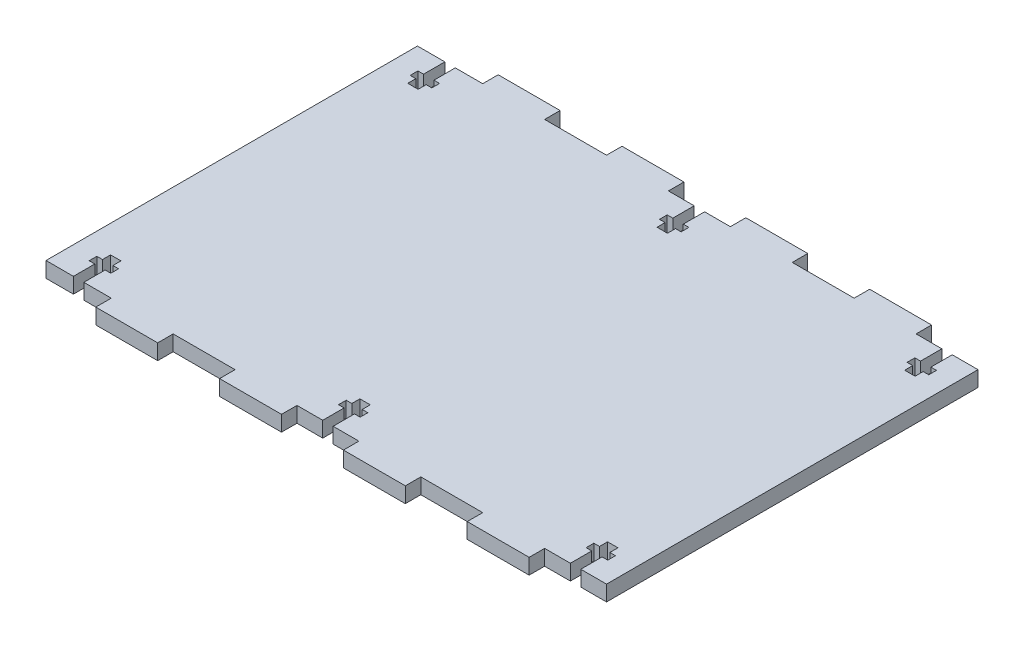
from build123d import *

# Parameters (mm, degrees)
SKETCH1_W           = 229.969358589
SKETCH1_H           = 6.35
BOSS_EXTRUDE1_DEPTH = 152.4
SKETCH2_W           = 25.4
SKETCH2_H           = 6.35
BOSS_EXTRUDE2_DEPTH = 6.35
LPATTERN1_COUNT     = 4
LPATTERN1_PITCH     = 50.8
SKETCH3_W           = 25.4
SKETCH3_H           = 6.35
BOSS_EXTRUDE3_DEPTH = 6.35
LPATTERN2_COUNT     = 4
LPATTERN2_PITCH     = 50.8
CUT_EXTRUDE1_DEPTH  = 6.35


with BuildPart() as part:
    # Sketch1 → Boss-Extrude1 (new body)
    with BuildSketch(Plane.XY):
        with Locations((-24.365205383, 152.4)):
            Rectangle(SKETCH1_W, SKETCH1_H)
    extrude(amount=BOSS_EXTRUDE1_DEPTH)

    # Sketch2 → Boss-Extrude2 (add)
    with BuildSketch(Plane(origin=(0, 155.575, 0), x_dir=(1, 0, 0), z_dir=(0, 1, 0))):
        with Locations((52.519473912, 3.175)):
            Rectangle(SKETCH2_W, SKETCH2_H)
    boss_extrude2 = extrude(amount=-BOSS_EXTRUDE2_DEPTH)

    # LPattern1: Boss-Extrude2 ×4
    with Locations(*[(-i * LPATTERN1_PITCH, 0, 0) for i in range(1, LPATTERN1_COUNT)]):
        add(boss_extrude2)

    # Sketch3 → Boss-Extrude3 (add)
    with BuildSketch(Plane.XY.offset(152.4)):
        with Locations((52.519473912, 152.4)):
            Rectangle(SKETCH3_W, SKETCH3_H)
    boss_extrude3 = extrude(amount=BOSS_EXTRUDE3_DEPTH)

    # LPattern2: Boss-Extrude3 ×4
    with Locations(*[(-i * LPATTERN2_PITCH, 0, 0) for i in range(1, LPATTERN2_COUNT)]):
        add(boss_extrude3)

    # Sketch4 → Cut-Extrude1 (cut)
    with BuildSketch(Plane(origin=(0, 155.575, 0), x_dir=(1, 0, 0), z_dir=(0, 1, 0))):
        Polygon((-123.831605383, 0), (-128.098805383, 0), (-128.098805383, -8.763), (-130.410205383, -8.763), (-130.410205383, -11.938), (-128.098805383, -11.938), (-128.098805383, -15.24), (-123.831605383, -15.24), (-123.831605383, -11.938), (-121.520205383, -11.938), (-121.520205383, -8.763), (-123.831605383, -8.763), align=None)
        Polygon((-21.546926088, 0), (-25.814126088, 0), (-25.814126088, -8.763), (-28.125526088, -8.763), (-28.125526088, -11.938), (-25.814126088, -11.938), (-25.814126088, -15.24), (-21.546926088, -15.24), (-21.546926088, -11.938), (-19.235526088, -11.938), (-19.235526088, -8.763), (-21.546926088, -8.763), align=None)
        Polygon((80.053073912, 0), (75.785873912, 0), (75.785873912, -8.763), (73.474473912, -8.763), (73.474473912, -11.938), (75.785873912, -11.938), (75.785873912, -15.24), (80.053073912, -15.24), (80.053073912, -11.938), (82.364473912, -11.938), (82.364473912, -8.763), (80.053073912, -8.763), align=None)
        Polygon((-128.098805383, -152.4), (-123.831605383, -152.4), (-123.831605383, -143.637), (-121.520205383, -143.637), (-121.520205383, -140.462), (-123.831605383, -140.462), (-123.831605383, -137.16), (-128.098805383, -137.16), (-128.098805383, -140.462), (-130.410205383, -140.462), (-130.410205383, -143.637), (-128.098805383, -143.637), align=None)
        Polygon((-25.814126088, -152.4), (-21.546926088, -152.4), (-21.546926088, -143.637), (-19.235526088, -143.637), (-19.235526088, -140.462), (-21.546926088, -140.462), (-21.546926088, -137.16), (-25.814126088, -137.16), (-25.814126088, -140.462), (-28.125526088, -140.462), (-28.125526088, -143.637), (-25.814126088, -143.637), align=None)
        Polygon((75.785873912, -152.4), (80.053073912, -152.4), (80.053073912, -143.637), (82.364473912, -143.637), (82.364473912, -140.462), (80.053073912, -140.462), (80.053073912, -137.16), (75.785873912, -137.16), (75.785873912, -140.462), (73.474473912, -140.462), (73.474473912, -143.637), (75.785873912, -143.637), align=None)
    extrude(amount=-CUT_EXTRUDE1_DEPTH, mode=Mode.SUBTRACT)


solid = part.part
